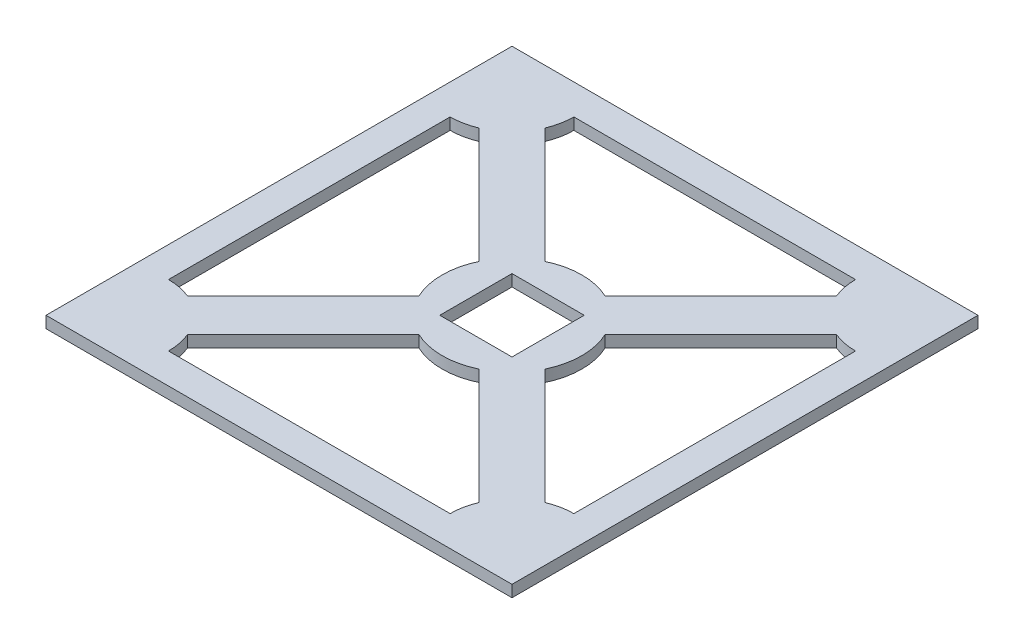
from build123d import *

# Parameters (mm, degrees)
SKETCH1_W           = 100
SKETCH1_H           = 100
BOSS_EXTRUDE1_DEPTH = 2.5
SKETCH5_W           = 87
SKETCH5_H           = 87
CUT_EXTRUDE2_DEPTH  = 4
SKETCH6_R           = 15
BOSS_EXTRUDE3_DEPTH = 2.5
SKETCH7_W           = 15.5
SKETCH7_H           = 15.5
CUT_EXTRUDE3_DEPTH  = 2.5
BOSS_EXTRUDE4_DEPTH = 2.5
EXTRUDE_THIN2_DEPTH = 2.5


with BuildPart() as part:
    # Sketch1 → Boss-Extrude1 (new body)
    with BuildSketch(Plane(origin=(0, 0, 0), x_dir=(1, 0, 0), z_dir=(0, 1, 0))):
        Rectangle(SKETCH1_W, SKETCH1_H)
    extrude(amount=BOSS_EXTRUDE1_DEPTH)

    # Sketch5 → Cut-Extrude2 (cut)
    with BuildSketch(Plane(origin=(0, 2.5, 0), x_dir=(1, 0, 0), z_dir=(0, 1, 0))):
        Rectangle(SKETCH5_W, SKETCH5_H)
    extrude(amount=-CUT_EXTRUDE2_DEPTH, mode=Mode.SUBTRACT)

    # Sketch8 → Boss-Extrude4 (add)
    with BuildSketch(Plane(origin=(0, 2.5, 0), x_dir=(1, 0, 0), z_dir=(0, 1, 0))):
        with BuildLine():
            ThreePointArc((43.5, -30.220069463), (34.109671064, -34.109671064), (30.220069463, -43.5))
            Line((30.220069463, -43.5), (43.5, -43.5))
            Line((43.5, -43.5), (43.5, -30.220069463))
        make_face()
        with BuildLine():
            Line((-43.5, -43.5), (-30.220069463, -43.5))
            ThreePointArc((-30.220069463, -43.5), (-34.109671064, -34.109671064), (-43.5, -30.220069463))
            Line((-43.5, -30.220069463), (-43.5, -43.5))
        make_face()
        with BuildLine():
            ThreePointArc((-43.5, 30.220069463), (-34.109671064, 34.109671064), (-30.220069463, 43.5))
            Line((-30.220069463, 43.5), (-43.5, 43.5))
            Line((-43.5, 43.5), (-43.5, 30.220069463))
        make_face()
        with BuildLine():
            Line((43.5, 43.5), (30.220069463, 43.5))
            ThreePointArc((30.220069463, 43.5), (34.109671064, 34.109671064), (43.5, 30.220069463))
            Line((43.5, 30.220069463), (43.5, 43.5))
        make_face()
    extrude(amount=-BOSS_EXTRUDE4_DEPTH)



with BuildPart() as body_2:
    # Sketch6 → Boss-Extrude3 (new body)
    with BuildSketch(Plane(origin=(0, 2.5, 0), x_dir=(1, 0, 0), z_dir=(0, 1, 0))):
        Circle(SKETCH6_R)
    extrude(amount=-BOSS_EXTRUDE3_DEPTH)

    # Sketch7 → Cut-Extrude3 (cut)
    with BuildSketch(Plane(origin=(0, 2.5, 0), x_dir=(1, 0, 0), z_dir=(0, 1, 0))):
        Rectangle(SKETCH7_W, SKETCH7_H)
    extrude(amount=-CUT_EXTRUDE3_DEPTH, mode=Mode.SUBTRACT)


with BuildPart() as part_1:
    add(part.part)

    add(body_2.part)  # Extrude-Thin2 merges body 2
    # Sketch9 → Extrude-Thin2 (add)
    with BuildSketch(Plane(origin=(0, 2.5, 0), x_dir=(1, 0, 0), z_dir=(0, 1, 0))):
        Polygon((4.214466094, -11.285533906), (34.46870341, -41.539771222), (41.539771222, -34.46870341), (11.285533906, -4.214466094), align=None)
        Polygon((-11.285533906, -4.214466094), (-41.539771222, -34.46870341), (-34.46870341, -41.539771222), (-4.214466094, -11.285533906), align=None)
        Polygon((11.285533906, 4.214466094), (41.539771222, 34.46870341), (34.46870341, 41.539771222), (4.214466094, 11.285533906), align=None)
        Polygon((-4.214466094, 11.285533906), (-34.46870341, 41.539771222), (-41.539771222, 34.46870341), (-11.285533906, 4.214466094), align=None)
    extrude(amount=-EXTRUDE_THIN2_DEPTH)


solid = part_1.part
